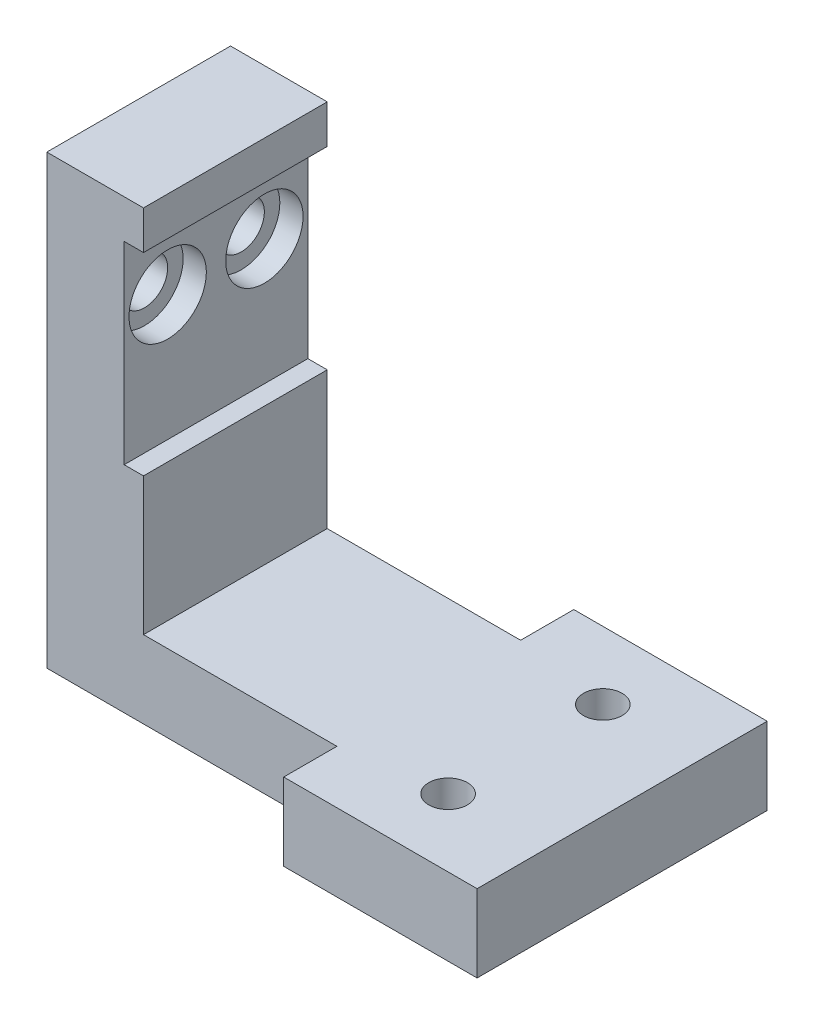
from build123d import *

# Parameters (mm, degrees)
BOSS_EXTRUDE1_DEPTH         = 4.75
M2_CLEARANCE_HOLE1_D        = 2.4
SKETCH4_R                   = 2
CUT_EXTRUDE1_DEPTH          = 1.2
SKETCH5_W                   = 10
SKETCH5_H                   = 15
BOSS_EXTRUDE2_DEPTH         = 4
TAP_DRILL_FOR_M2X0_4_TAP2_D = 2


with BuildPart() as part:
    # Sketch1 → Boss-Extrude1 (new, symmetric)
    with BuildSketch(Plane.XY):
        Polygon((-17.53737418, 3), (-17.53737418, 13), (-16.53737418, 13), (-16.53737418, 15), (-21.53737418, 15), (-21.53737418, 0), (-21.53737418, -8.11), (-13.42737418, -8.11), (3.46262582, -8.11), (3.46262582, -4.11), (-12.42737418, -4.11), (-16.53737418, -4.11), (-16.53737418, 0), (-16.53737418, 3), align=None)
    extrude(amount=BOSS_EXTRUDE1_DEPTH, both=True)

    # M2 Clearance Hole1 (through all)
    with Locations(Plane(origin=(-17.53737418, 9.5, 2.5), x_dir=(0, 0, 1), z_dir=(1, 0, 0))):
        with Locations((0, 0), (-5, 0)):
            Hole(M2_CLEARANCE_HOLE1_D / 2)

    # Sketch4 → Cut-Extrude1 (cut)
    with BuildSketch(Plane(origin=(-17.53737418, 0, 0), x_dir=(0, 0, -1), z_dir=(1, 0, 0))):
        with Locations((-2.5, 9.5)):
            Circle(SKETCH4_R)
        with Locations((2.5, 9.5)):
            Circle(SKETCH4_R)
    extrude(amount=-CUT_EXTRUDE1_DEPTH, mode=Mode.SUBTRACT)

    # Sketch5 → Boss-Extrude2 (add)
    with BuildSketch(Plane.XZ.offset(8.11)):
        with Locations((-1.53737418, 0)):
            Rectangle(SKETCH5_W, SKETCH5_H)
    extrude(amount=-BOSS_EXTRUDE2_DEPTH)

    # Tap Drill for M2x0.4 Tap2 (through all)
    with Locations(Plane(origin=(-1.53737418, -4.11, 4), x_dir=(0, 0, 1), z_dir=(0, 1, 0))):
        with Locations((0, 0), (-8, 0)):
            Hole(TAP_DRILL_FOR_M2X0_4_TAP2_D / 2)


solid = part.part
